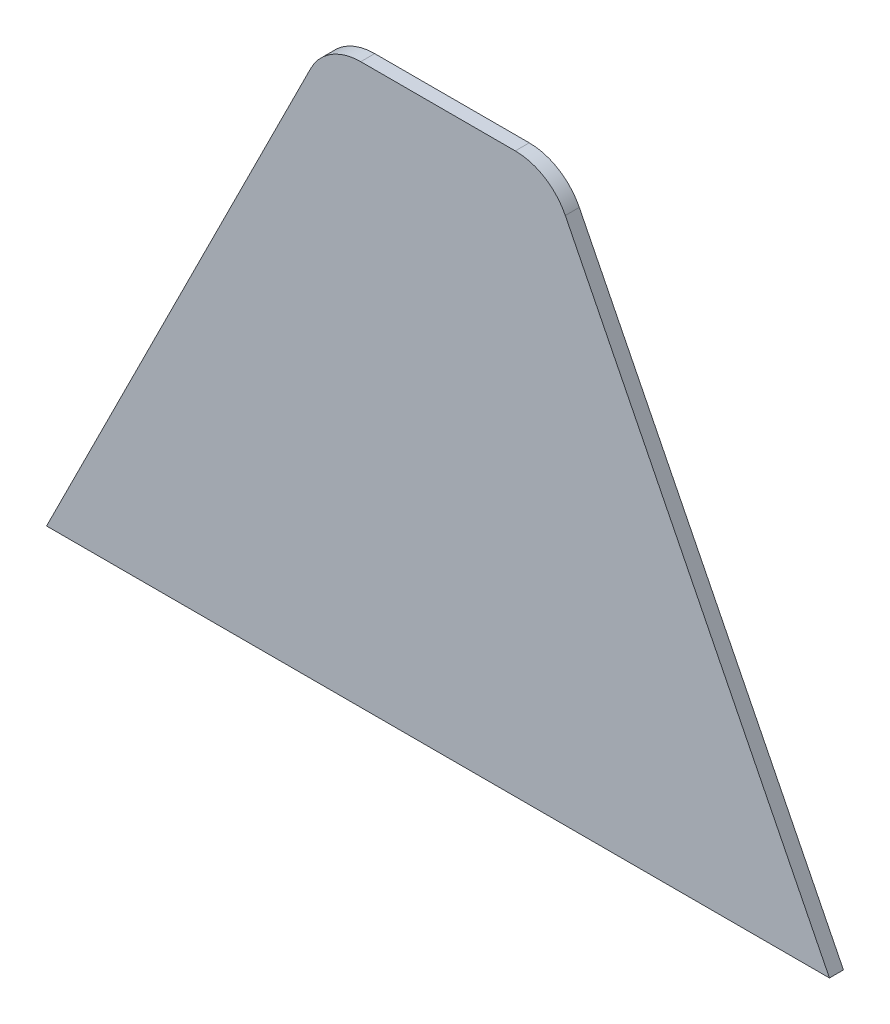
from build123d import *

# Parameters (mm, degrees)
MAINSHAPE_DEPTH = 3.175
FILLET1_R       = 12.7


with BuildPart() as part:
    # Sketch1 → MainShape (new body)
    with BuildSketch(Plane.XY):
        Polygon((0, 0), (63.5, 127), (114.3, 127), (177.8, 0), align=None)
    extrude(amount=MAINSHAPE_DEPTH)

    # Fillet1
    fillet1_edges = [part.edges().sort_by_distance(p)[0] for p in [
        (114.3, 127, 1.5875),
        (63.5, 127, 1.5875),
    ]]
    fillet(fillet1_edges, radius=FILLET1_R)


solid = part.part
